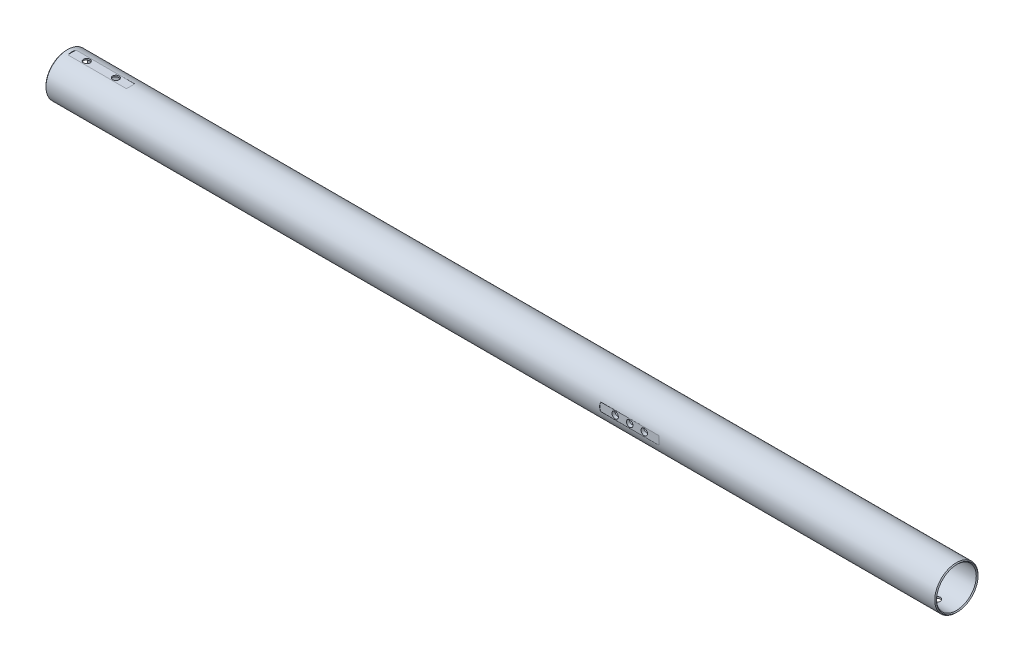
from build123d import *

# Parameters (mm, degrees)
SKETCH1_R                     = 25
SKETCH1_R_2                   = 23
EXTRUDE_THIN1_DEPTH           = 515
EXTRUDE_THIN2_START           = 210
SKETCH1_3_R                   = 25
SKETCH1_3_R_2                 = 21
EXTRUDE_THIN2_DEPTH           = 90
CUT_EXTRUDE1_START            = 24.54
CUT_EXTRUDE1_DEPTH            = 492.672165684
CUT_EXTRUDE2_START            = -24.54
CUT_EXTRUDE2_DEPTH            = 492.672165793
CUT_EXTRUDE3_START            = -24.54
CUT_EXTRUDE3_DEPTH            = 492.672165793
CUT_EXTRUDE4_START            = 24.54
CUT_EXTRUDE4_DEPTH            = 492.672165793
M_0_295_DIAMETER_HOLE3_REACH  = 519.981
M_0_295_DIAMETER_HOLE3_BORE_R = 3.7465
M_0_295_DIAMETER_HOLE4_REACH  = 519.981
M_0_295_DIAMETER_HOLE4_BORE_R = 3.7465
M_0_295_DIAMETER_HOLE5_REACH  = 519.981
M_0_295_DIAMETER_HOLE5_BORE_R = 3.7465
M_0_295_DIAMETER_HOLE6_REACH  = 519.981
M_0_295_DIAMETER_HOLE6_BORE_R = 3.7465
CHAMFER1_SIZE                 = 1


with BuildPart() as part:
    # Sketch1 → Extrude-Thin1 (new, symmetric)
    with BuildSketch(Plane(origin=(0, 0, 0), x_dir=(0, 0, -1), z_dir=(1, 0, 0))):
        Circle(SKETCH1_R)
        Circle(SKETCH1_R_2, mode=Mode.SUBTRACT)
    extrude(amount=EXTRUDE_THIN1_DEPTH, both=True)

    # Sketch1<3> → Extrude-Thin2 (add)
    with BuildSketch(Plane(origin=(0, 0, 0), x_dir=(0, 0, -1), z_dir=(1, 0, 0)).offset(EXTRUDE_THIN2_START)):
        Circle(SKETCH1_3_R)
        Circle(SKETCH1_3_R_2, mode=Mode.SUBTRACT)
    extrude(amount=-EXTRUDE_THIN2_DEPTH)

    # Sketch3 → Cut-Extrude1 (cut, through all)
    with BuildSketch(Plane(origin=(0, 0, 0), x_dir=(1, 0, 0), z_dir=(0, 1, 0)).offset(CUT_EXTRUDE1_START)):
        with BuildLine():
            Line((-491.7775, -17.4725), (-458.1225, -17.4725))
            ThreePointArc((-458.1225, -17.4725), (-440.65, 0), (-458.1225, 17.4725))
            Line((-458.1225, 17.4725), (-491.7775, 17.4725))
            ThreePointArc((-491.7775, 17.4725), (-509.25, 0), (-491.7775, -17.4725))
        make_face()
    extrude(amount=CUT_EXTRUDE1_DEPTH, mode=Mode.SUBTRACT)

    # Sketch8 → Cut-Extrude2 (cut, through all)
    with BuildSketch(Plane.XY.offset(CUT_EXTRUDE2_START)):
        with BuildLine():
            Line((-272.5275, -17.4725), (-238.8725, -17.4725))
            ThreePointArc((-238.8725, -17.4725), (-221.4, 0), (-238.8725, 17.4725))
            Line((-238.8725, 17.4725), (-272.5275, 17.4725))
            ThreePointArc((-272.5275, 17.4725), (-290, 0), (-272.5275, -17.4725))
        make_face()
    extrude(amount=-CUT_EXTRUDE2_DEPTH, mode=Mode.SUBTRACT)

    # Sketch3<3> → Cut-Extrude3 (cut, through all)
    with BuildSketch(Plane(origin=(0, 0, 0), x_dir=(1, 0, 0), z_dir=(0, 1, 0)).offset(CUT_EXTRUDE3_START)):
        with BuildLine():
            ThreePointArc((458.1225, -17.4725), (440.65, 0), (458.1225, 17.4725))
            Line((458.1225, 17.4725), (491.7775, 17.4725))
            ThreePointArc((491.7775, 17.4725), (509.25, 0), (491.7775, -17.4725))
            Line((491.7775, -17.4725), (458.1225, -17.4725))
        make_face()
    extrude(amount=-CUT_EXTRUDE3_DEPTH, mode=Mode.SUBTRACT)

    # Sketch8<4> → Cut-Extrude4 (cut, through all)
    with BuildSketch(Plane.XY.offset(CUT_EXTRUDE4_START)):
        with BuildLine():
            Line((143.8725, -17.4725), (177.5275, -17.4725))
            ThreePointArc((177.5275, -17.4725), (195, 0), (177.5275, 17.4725))
            Line((177.5275, 17.4725), (143.8725, 17.4725))
            ThreePointArc((143.8725, 17.4725), (126.4, 0), (143.8725, -17.4725))
        make_face()
    extrude(amount=CUT_EXTRUDE4_DEPTH, mode=Mode.SUBTRACT)

    # M (0.295) Diameter Hole3 bore → M (0.295) Diameter Hole3 (cut, up to next)
    with BuildSketch(Plane(origin=(0, 24.54, 0), x_dir=(1, 0, 0), z_dir=(0, 1, 0)), mode=Mode.PRIVATE) as m_0_295_diameter_hole3_sk1:
        with Locations((-491.7775, 0)):
            Circle(M_0_295_DIAMETER_HOLE3_BORE_R)
    m_0_295_diameter_hole3_tool1 = extrude(m_0_295_diameter_hole3_sk1.sketch, amount=-M_0_295_DIAMETER_HOLE3_REACH, mode=Mode.PRIVATE) & part.part
    # M (0.295) Diameter Hole3 bore → M (0.295) Diameter Hole3 (cut, up to next)
    with BuildSketch(Plane(origin=(0, 24.54, 0), x_dir=(1, 0, 0), z_dir=(0, 1, 0)), mode=Mode.PRIVATE) as m_0_295_diameter_hole3_sk2:
        with Locations((-458.1225, 0)):
            Circle(M_0_295_DIAMETER_HOLE3_BORE_R)
    m_0_295_diameter_hole3_tool2 = extrude(m_0_295_diameter_hole3_sk2.sketch, amount=-M_0_295_DIAMETER_HOLE3_REACH, mode=Mode.PRIVATE) & part.part
    add(m_0_295_diameter_hole3_tool1.solids().sort_by_distance((-491.7775, 24.54, 0))[0], mode=Mode.SUBTRACT)
    add(m_0_295_diameter_hole3_tool2.solids().sort_by_distance((-458.1225, 24.54, 0))[0], mode=Mode.SUBTRACT)

    # M (0.295) Diameter Hole4 bore → M (0.295) Diameter Hole4 (cut, up to next)
    with BuildSketch(Plane(origin=(0, 0, -24.54), x_dir=(-1, 0, 0), z_dir=(0, 0, -1)), mode=Mode.PRIVATE) as m_0_295_diameter_hole4_sk1:
        with Locations((238.8725, 0)):
            Circle(M_0_295_DIAMETER_HOLE4_BORE_R)
    m_0_295_diameter_hole4_tool1 = extrude(m_0_295_diameter_hole4_sk1.sketch, amount=-M_0_295_DIAMETER_HOLE4_REACH, mode=Mode.PRIVATE) & part.part
    # M (0.295) Diameter Hole4 bore → M (0.295) Diameter Hole4 (cut, up to next)
    with BuildSketch(Plane(origin=(0, 0, -24.54), x_dir=(-1, 0, 0), z_dir=(0, 0, -1)), mode=Mode.PRIVATE) as m_0_295_diameter_hole4_sk2:
        with Locations((272.5275, 0)):
            Circle(M_0_295_DIAMETER_HOLE4_BORE_R)
    m_0_295_diameter_hole4_tool2 = extrude(m_0_295_diameter_hole4_sk2.sketch, amount=-M_0_295_DIAMETER_HOLE4_REACH, mode=Mode.PRIVATE) & part.part
    add(m_0_295_diameter_hole4_tool1.solids().sort_by_distance((-238.8725, 0, -24.54))[0], mode=Mode.SUBTRACT)
    add(m_0_295_diameter_hole4_tool2.solids().sort_by_distance((-272.5275, 0, -24.54))[0], mode=Mode.SUBTRACT)

    # M (0.295) Diameter Hole5 bore → M (0.295) Diameter Hole5 (cut, up to next)
    with BuildSketch(Plane.XY.offset(24.54), mode=Mode.PRIVATE) as m_0_295_diameter_hole5_sk1:
        with Locations((143.8725, 0)):
            Circle(M_0_295_DIAMETER_HOLE5_BORE_R)
    m_0_295_diameter_hole5_tool1 = extrude(m_0_295_diameter_hole5_sk1.sketch, amount=-M_0_295_DIAMETER_HOLE5_REACH, mode=Mode.PRIVATE) & part.part
    # M (0.295) Diameter Hole5 bore → M (0.295) Diameter Hole5 (cut, up to next)
    with BuildSketch(Plane.XY.offset(24.54), mode=Mode.PRIVATE) as m_0_295_diameter_hole5_sk2:
        with Locations((160.7, 0)):
            Circle(M_0_295_DIAMETER_HOLE5_BORE_R)
    m_0_295_diameter_hole5_tool2 = extrude(m_0_295_diameter_hole5_sk2.sketch, amount=-M_0_295_DIAMETER_HOLE5_REACH, mode=Mode.PRIVATE) & part.part
    # M (0.295) Diameter Hole5 bore → M (0.295) Diameter Hole5 (cut, up to next)
    with BuildSketch(Plane.XY.offset(24.54), mode=Mode.PRIVATE) as m_0_295_diameter_hole5_sk3:
        with Locations((177.5275, 0)):
            Circle(M_0_295_DIAMETER_HOLE5_BORE_R)
    m_0_295_diameter_hole5_tool3 = extrude(m_0_295_diameter_hole5_sk3.sketch, amount=-M_0_295_DIAMETER_HOLE5_REACH, mode=Mode.PRIVATE) & part.part
    add(m_0_295_diameter_hole5_tool1.solids().sort_by_distance((143.8725, 0, 24.54))[0], mode=Mode.SUBTRACT)
    add(m_0_295_diameter_hole5_tool2.solids().sort_by_distance((160.7, 0, 24.54))[0], mode=Mode.SUBTRACT)
    add(m_0_295_diameter_hole5_tool3.solids().sort_by_distance((177.5275, 0, 24.54))[0], mode=Mode.SUBTRACT)

    # M (0.295) Diameter Hole6 bore → M (0.295) Diameter Hole6 (cut, up to next)
    with BuildSketch(Plane(origin=(0, -24.54, 0), x_dir=(-1, 0, 0), z_dir=(0, -1, 0)), mode=Mode.PRIVATE) as m_0_295_diameter_hole6_sk1:
        with Locations((-491.7775, 0)):
            Circle(M_0_295_DIAMETER_HOLE6_BORE_R)
    m_0_295_diameter_hole6_tool1 = extrude(m_0_295_diameter_hole6_sk1.sketch, amount=-M_0_295_DIAMETER_HOLE6_REACH, mode=Mode.PRIVATE) & part.part
    # M (0.295) Diameter Hole6 bore → M (0.295) Diameter Hole6 (cut, up to next)
    with BuildSketch(Plane(origin=(0, -24.54, 0), x_dir=(-1, 0, 0), z_dir=(0, -1, 0)), mode=Mode.PRIVATE) as m_0_295_diameter_hole6_sk2:
        with Locations((-458.1225, 0)):
            Circle(M_0_295_DIAMETER_HOLE6_BORE_R)
    m_0_295_diameter_hole6_tool2 = extrude(m_0_295_diameter_hole6_sk2.sketch, amount=-M_0_295_DIAMETER_HOLE6_REACH, mode=Mode.PRIVATE) & part.part
    add(m_0_295_diameter_hole6_tool1.solids().sort_by_distance((491.7775, -24.54, 0))[0], mode=Mode.SUBTRACT)
    add(m_0_295_diameter_hole6_tool2.solids().sort_by_distance((458.1225, -24.54, 0))[0], mode=Mode.SUBTRACT)

    # Chamfer1
    chamfer1_edges = [part.edges().sort_by_distance(p)[0] for p in [
        (-515, 0, 25),
        (-515, 0, 23),
        (515, 0, 25),
        (515, 0, 23),
    ]]
    chamfer(chamfer1_edges, length=CHAMFER1_SIZE - 0.0001)  # a hair under: the kernel refuses the full size


solid = part.part
